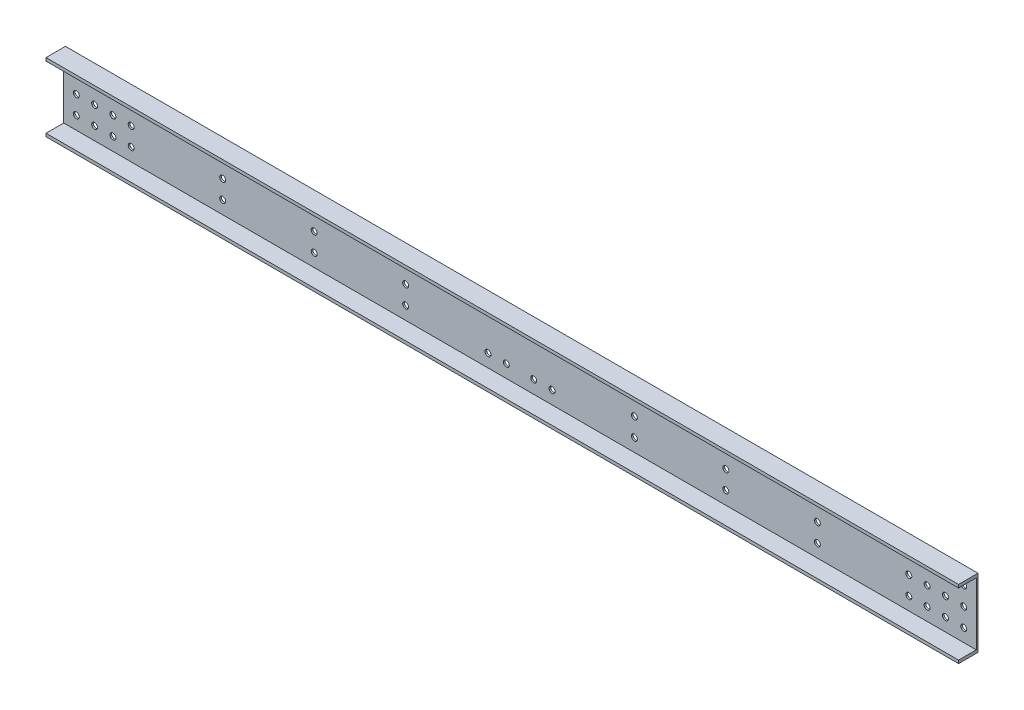
from build123d import *

# Parameters (mm, degrees)
SKETCH_1_W                       = 3990
SKETCH_1_H                       = 300
SKETCH_1_R                       = 13
EXTRUDE_709_DEPTH                = 7.5
SKETCH_2_W                       = 3990
SKETCH_2_H                       = 13.5
EXTRUDE_1_DEPTH                  = 77.5
SKETCH_3_R                       = 13
CUT_EXTRUDE_1_DEPTH              = 2003.436016456
PATTERN_LINEAR_1_COUNT           = 3
PATTERN_LINEAR_1_PITCH           = 400
PATTERN_LINEAR_2_COUNT           = 2
PATTERN_LINEAR_2_PITCH           = 1800
PATTERN_LINEAR_2_COPY_1_SKETCH_R = 13
PATTERN_LINEAR_2_COPY_1_DEPTH    = 2003.436016456
PATTERN_LINEAR_2_COPY_2_SKETCH_R = 13
PATTERN_LINEAR_2_COPY_2_DEPTH    = 2003.436016456


with BuildPart() as part:
    # 草图1 → Extrude 709 (new body)
    with BuildSketch(Plane.XY):
        Rectangle(SKETCH_1_W, SKETCH_1_H)
        with Locations((1940, 0)):
            Circle(SKETCH_1_R, mode=Mode.SUBTRACT)
        with Locations((1860, 0)):
            Circle(SKETCH_1_R, mode=Mode.SUBTRACT)
        with Locations((1780, 0)):
            Circle(SKETCH_1_R, mode=Mode.SUBTRACT)
        with Locations((1700, 0)):
            Circle(SKETCH_1_R, mode=Mode.SUBTRACT)
        with Locations((1700, 80)):
            Circle(SKETCH_1_R, mode=Mode.SUBTRACT)
        with Locations((1780, 80)):
            Circle(SKETCH_1_R, mode=Mode.SUBTRACT)
        with Locations((1860, 80)):
            Circle(SKETCH_1_R, mode=Mode.SUBTRACT)
        with Locations((1940, 80)):
            Circle(SKETCH_1_R, mode=Mode.SUBTRACT)
        with Locations((1940, -80)):
            Circle(SKETCH_1_R, mode=Mode.SUBTRACT)
        with Locations((1860, -80)):
            Circle(SKETCH_1_R, mode=Mode.SUBTRACT)
        with Locations((1780, -80)):
            Circle(SKETCH_1_R, mode=Mode.SUBTRACT)
        with Locations((1700, -80)):
            Circle(SKETCH_1_R, mode=Mode.SUBTRACT)
        with Locations((-1700, -80)):
            Circle(SKETCH_1_R, mode=Mode.SUBTRACT)
        with Locations((-1780, -80)):
            Circle(SKETCH_1_R, mode=Mode.SUBTRACT)
        with Locations((-1860, -80)):
            Circle(SKETCH_1_R, mode=Mode.SUBTRACT)
        with Locations((-1940, -80)):
            Circle(SKETCH_1_R, mode=Mode.SUBTRACT)
        with Locations((-1940, 80)):
            Circle(SKETCH_1_R, mode=Mode.SUBTRACT)
        with Locations((-1860, 80)):
            Circle(SKETCH_1_R, mode=Mode.SUBTRACT)
        with Locations((-1780, 80)):
            Circle(SKETCH_1_R, mode=Mode.SUBTRACT)
        with Locations((-1700, 80)):
            Circle(SKETCH_1_R, mode=Mode.SUBTRACT)
        with Locations((-1700, 0)):
            Circle(SKETCH_1_R, mode=Mode.SUBTRACT)
        with Locations((-1780, 0)):
            Circle(SKETCH_1_R, mode=Mode.SUBTRACT)
        with Locations((-1860, 0)):
            Circle(SKETCH_1_R, mode=Mode.SUBTRACT)
        with Locations((-1940, 0)):
            Circle(SKETCH_1_R, mode=Mode.SUBTRACT)
        with Locations((60, 80)):
            Circle(SKETCH_1_R, mode=Mode.SUBTRACT)
        with Locations((140, 80)):
            Circle(SKETCH_1_R, mode=Mode.SUBTRACT)
        with Locations((140, -80)):
            Circle(SKETCH_1_R, mode=Mode.SUBTRACT)
        with Locations((60, -80)):
            Circle(SKETCH_1_R, mode=Mode.SUBTRACT)
        with Locations((-60, -80)):
            Circle(SKETCH_1_R, mode=Mode.SUBTRACT)
        with Locations((-140, -80)):
            Circle(SKETCH_1_R, mode=Mode.SUBTRACT)
        with Locations((-140, 80)):
            Circle(SKETCH_1_R, mode=Mode.SUBTRACT)
        with Locations((-60, 80)):
            Circle(SKETCH_1_R, mode=Mode.SUBTRACT)
    extrude(amount=EXTRUDE_709_DEPTH)

    # 草图2 → 凸台-拉伸1 (add)
    with BuildSketch(Plane.XY.offset(7.5)):
        with Locations((0, 143.25)):
            Rectangle(SKETCH_2_W, SKETCH_2_H)
        with Locations((0, -143.25)):
            Rectangle(SKETCH_2_W, SKETCH_2_H)
    extrude(amount=EXTRUDE_1_DEPTH)

    # 草图3 → 切除-拉伸1 (cut, through all)
    with BuildSketch(Plane(origin=(0, 0, 0), x_dir=(-1, 0, 0), z_dir=(0, 0, -1))):
        with Locations((-1300, 80)):
            Circle(SKETCH_3_R)
        with Locations((-1300, 0)):
            Circle(SKETCH_3_R)
        with Locations((-1300, -80)):
            Circle(SKETCH_3_R)
    cut_extrude_1 = extrude(amount=-CUT_EXTRUDE_1_DEPTH, mode=Mode.SUBTRACT)

    # 阵列(线性)1: 切除-拉伸1 ×3
    with Locations(*[(-i * PATTERN_LINEAR_1_PITCH, 0, 0) for i in range(1, PATTERN_LINEAR_1_COUNT)]):
        add(cut_extrude_1, mode=Mode.SUBTRACT)

    # 阵列(线性)2: 切除-拉伸1 ×2
    with Locations(*[(-i * PATTERN_LINEAR_2_PITCH, 0, 0) for i in range(1, PATTERN_LINEAR_2_COUNT)]):
        add(cut_extrude_1, mode=Mode.SUBTRACT)

    # 阵列(线性)2 copy 1 sketch → 阵列(线性)2 copy 1 (cut, through all)
    with BuildSketch(Plane(origin=(-2200, 0, 0), x_dir=(-1, 0, 0), z_dir=(0, 0, -1))):
        with Locations((-1300, 80)):
            Circle(PATTERN_LINEAR_2_COPY_1_SKETCH_R)
        with Locations((-1300, 0)):
            Circle(PATTERN_LINEAR_2_COPY_1_SKETCH_R)
        with Locations((-1300, -80)):
            Circle(PATTERN_LINEAR_2_COPY_1_SKETCH_R)
    extrude(amount=-PATTERN_LINEAR_2_COPY_1_DEPTH, mode=Mode.SUBTRACT)

    # 阵列(线性)2 copy 2 sketch → 阵列(线性)2 copy 2 (cut, through all)
    with BuildSketch(Plane(origin=(-2600, 0, 0), x_dir=(-1, 0, 0), z_dir=(0, 0, -1))):
        with Locations((-1300, 80)):
            Circle(PATTERN_LINEAR_2_COPY_2_SKETCH_R)
        with Locations((-1300, 0)):
            Circle(PATTERN_LINEAR_2_COPY_2_SKETCH_R)
        with Locations((-1300, -80)):
            Circle(PATTERN_LINEAR_2_COPY_2_SKETCH_R)
    extrude(amount=-PATTERN_LINEAR_2_COPY_2_DEPTH, mode=Mode.SUBTRACT)


solid = part.part
